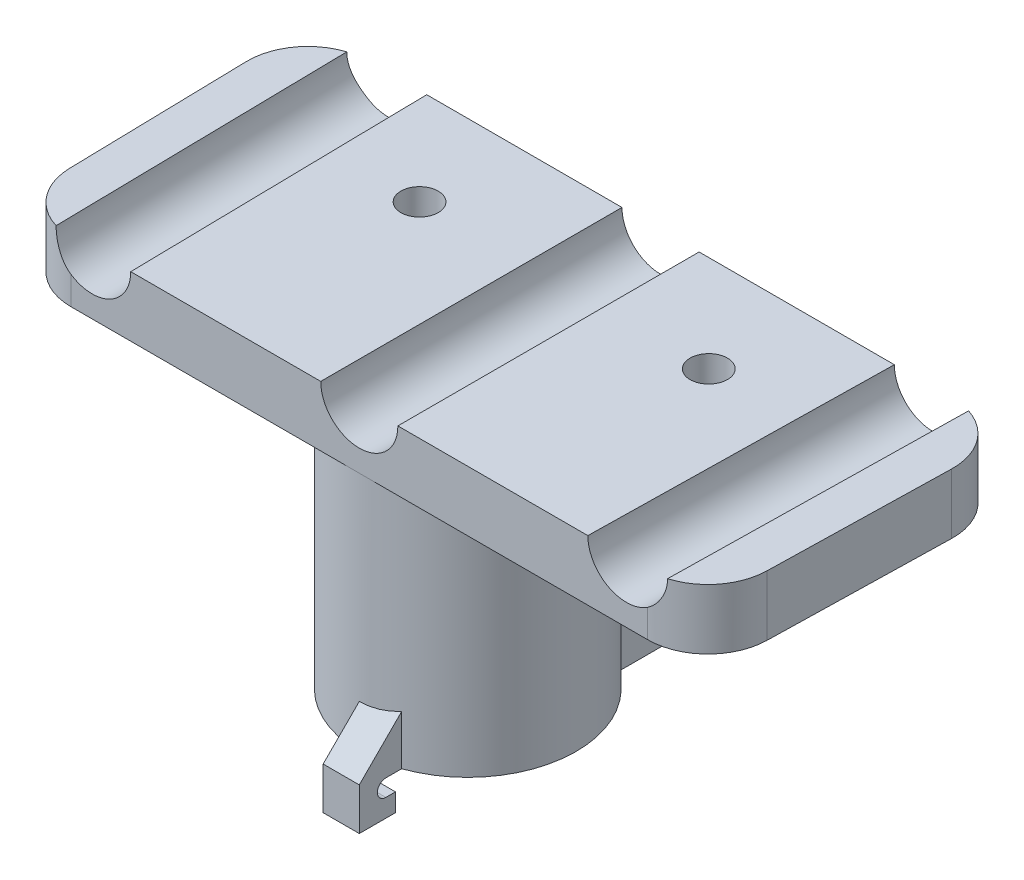
from build123d import *

# Parameters (mm, degrees)
BOSS_EXTRUDE1_DEPTH             = 5
SKETCH2_R                       = 9
SKETCH2_R_2                     = 6
BOSS_EXTRUDE2_DEPTH             = 20
SKETCH3_W                       = 10
SKETCH3_H                       = 8.516685226
BOSS_EXTRUDE3_DEPTH             = 20
SKETCH5_R                       = 3.2
CUT_EXTRUDE1_DEPTH              = 44.458424087
CIRPATTERN1_COUNT               = 2
CIRPATTERN1_ANGLE               = 1
CIRPATTERN1_THE_OTHER_WAY_COUNT = 2
CIRPATTERN1_THE_OTHER_WAY_ANGLE = 1
CUT_EXTRUDE2_REACH              = 45.458
CUT_EXTRUDE2_END_RADIUS         = 6
SKETCH6_R                       = 2
CUT_EXTRUDE2_DIRECTION_2_DEPTH  = 44.458424087
CUT_EXTRUDE3_START              = -3.3
CUT_EXTRUDE3_DEPTH              = 3
BOSS_EXTRUDE4_DEPTH             = 3
FILLET1_START                   = -20
FILLET1_DEPTH                   = 25
CUT_EXTRUDE4_DEPTH              = 1
SKETCH10_R                      = 1.55
CUT_EXTRUDE5_DEPTH              = 46.311291634


with BuildPart() as part:
    # Sketch1 → Boss-Extrude1 (new body)
    with BuildSketch(Plane(origin=(0, 0, 0), x_dir=(1, 0, 0), z_dir=(0, 1, 0))):
        Polygon((-28.820331722, 0), (-29.387661087, 25), (29.387661087, 25), (28.820331722, 0), align=None)
    extrude(amount=BOSS_EXTRUDE1_DEPTH)

    # Sketch2 → Boss-Extrude2 (add)
    with BuildSketch(Plane.XZ):
        with Locations(Location((0, -9, 0), (0, 0, 90))):
            Circle(SKETCH2_R)
        with Locations(Location((0, -9, 0), (0, 0, 270))):
            Circle(SKETCH2_R_2, mode=Mode.SUBTRACT)
    extrude(amount=BOSS_EXTRUDE2_DEPTH)

    # Sketch3 → Boss-Extrude3 (add)
    with BuildSketch(Plane.XZ):
        with Locations((0, -20.741657387)):
            Rectangle(SKETCH3_W, SKETCH3_H)
    extrude(amount=BOSS_EXTRUDE3_DEPTH)

    # Sketch5 → Cut-Extrude1 (cut, symmetric)
    with BuildSketch(Plane.XY):
        with Locations((0, 5)):
            Circle(SKETCH5_R)
    cut_extrude1 = extrude(amount=CUT_EXTRUDE1_DEPTH, both=True, mode=Mode.SUBTRACT)

    # CirPattern1: Cut-Extrude1 ×2 about axis
    cirpattern1_axis = Axis((0, 0, 1270), (0, 1, 0))
    for i in range(1, CIRPATTERN1_COUNT):
        add(cut_extrude1.rotate(cirpattern1_axis, i * CIRPATTERN1_ANGLE / (CIRPATTERN1_COUNT - 1)), mode=Mode.SUBTRACT)

    # CirPattern1 the other way: Cut-Extrude1 ×2 about axis
    cirpattern1_the_other_way_axis = Axis((0, 0, 1270), (0, -1, 0))
    for i in range(1, CIRPATTERN1_THE_OTHER_WAY_COUNT):
        add(cut_extrude1.rotate(cirpattern1_the_other_way_axis, i * CIRPATTERN1_THE_OTHER_WAY_ANGLE / (CIRPATTERN1_THE_OTHER_WAY_COUNT - 1)), mode=Mode.SUBTRACT)

    # Cut-Extrude2: up to this cylinder (the profile starts outside it)
    cut_extrude2_end = Plane(origin=(0, -13, -9), z_dir=(0, 1, 0)) * Cylinder(CUT_EXTRUDE2_END_RADIUS, 103.916, mode=Mode.PRIVATE)
    # Sketch6 → Cut-Extrude2 (cut, up to the surface)
    with BuildSketch(Plane(origin=(0, 0, -25), x_dir=(-1, 0, 0), z_dir=(0, 0, -1)), mode=Mode.PRIVATE) as cut_extrude2_sk1:
        with Locations(Location((0, -13, 0), (0, 0, 180))):
            Circle(SKETCH6_R)
    cut_extrude2_tool1 = extrude(cut_extrude2_sk1.sketch, amount=-CUT_EXTRUDE2_REACH, mode=Mode.PRIVATE) - cut_extrude2_end
    add(cut_extrude2_tool1.solids().sort_by_distance((0, -13, -25))[0], mode=Mode.SUBTRACT)

    # Sketch6 → Cut-Extrude2 direction 2 (cut)
    with BuildSketch(Plane(origin=(0, 0, -25), x_dir=(-1, 0, 0), z_dir=(0, 0, -1))):
        with Locations(Location((0, -13, 0), (0, 0, 180))):
            Circle(SKETCH6_R)
    extrude(amount=CUT_EXTRUDE2_DIRECTION_2_DEPTH, mode=Mode.SUBTRACT)

    # Sketch7 → Cut-Extrude3 (cut)
    with BuildSketch(Plane(origin=(0, 0, -25), x_dir=(-1, 0, 0), z_dir=(0, 0, -1)).offset(CUT_EXTRUDE3_START)):
        Polygon((-3.55, -15.049593456), (-3.55, -20), (3.55, -20), (3.55, -15.049593456), (3.55, -10.950406544), (0, -8.900813089), (-3.55, -10.950406544), align=None)
    extrude(amount=-CUT_EXTRUDE3_DEPTH, mode=Mode.SUBTRACT)

    # Sketch8 → Boss-Extrude4 (add)
    with BuildSketch(Plane(origin=(0, 0, 0), x_dir=(0, 0, -1), z_dir=(1, 0, 0))):
        with BuildLine():
            Line((1, -15.4), (-3, -19.4))
            Line((-3, -19.4), (-3, -22.9))
            Line((-3, -22.9), (0, -22.9))
            Line((0, -22.9), (0, -21.4))
            Line((0, -21.4), (-0.8, -21.4))
            ThreePointArc((-0.8, -21.4), (-1.5, -20.7), (-0.8, -20))
            Line((-0.8, -20), (1, -20))
            Line((1, -20), (1, -15.4))
        make_face()
    extrude(amount=BOSS_EXTRUDE4_DEPTH)

    # Fillet1: read off the stored shape, not the designer's step
    # Fillet1 outline → Fillet1 (cut)
    with BuildSketch(Plane(origin=(0, 0, 0), x_dir=(1, 0, 0), z_dir=(0, 1, 0)).offset(FILLET1_START)):
        with BuildLine():
            Line((28.820331722, 0), (28.931223357, 4.886563332))
            ThreePointArc((28.931223357, 4.886563332), (27.427708206, 1.424585105), (23.93251031, 0))
            Line((23.93251031, 0), (28.820331722, 0))
        make_face()
        with BuildLine():
            ThreePointArc((24.272907929, 25), (27.848322824, 23.495197896), (29.271620976, 19.886563332))
            Line((29.271620976, 19.886563332), (29.387661087, 25))
            Line((29.387661087, 25), (24.272907929, 25))
        make_face()
        with BuildLine():
            Line((-28.820331722, 0), (-23.93251031, 0))
            ThreePointArc((-23.93251031, 0), (-27.427708206, 1.424585105), (-28.931223357, 4.886563332))
            Line((-28.931223357, 4.886563332), (-28.820331722, 0))
        make_face()
        with BuildLine():
            ThreePointArc((-29.271620976, 19.886563332), (-27.848322824, 23.495197896), (-24.272907929, 25))
            Line((-24.272907929, 25), (-29.387661087, 25))
            Line((-29.387661087, 25), (-29.271620976, 19.886563332))
        make_face()
    extrude(amount=FILLET1_DEPTH, mode=Mode.SUBTRACT)

    # Sketch9 → Cut-Extrude4 (cut)
    with BuildSketch(Plane.XZ):
        Polygon((12, -20.233161507), (14.8, -18.616580754), (14.8, -15.383419246), (12, -13.766838493), (9.2, -15.383419246), (9.2, -18.616580754), align=None)
    cut_extrude4 = extrude(amount=-CUT_EXTRUDE4_DEPTH, mode=Mode.SUBTRACT)

    # Sketch10 → Cut-Extrude5 (cut, through all)
    with BuildSketch(Plane.XZ.offset(-1)):
        with Locations(Location((12, -17, 0), (0, 0, 270))):
            Circle(SKETCH10_R)
    cut_extrude5 = extrude(amount=-CUT_EXTRUDE5_DEPTH, mode=Mode.SUBTRACT)

    # Mirror1: Cut-Extrude4, Cut-Extrude5 across plane
    add(cut_extrude4.mirror(Plane(origin=(0, 0, 0), x_dir=(0, 0, 1), z_dir=(1, 0, 0))), mode=Mode.SUBTRACT)
    add(cut_extrude5.mirror(Plane(origin=(0, 0, 0), x_dir=(0, 0, 1), z_dir=(1, 0, 0))), mode=Mode.SUBTRACT)


solid = part.part
